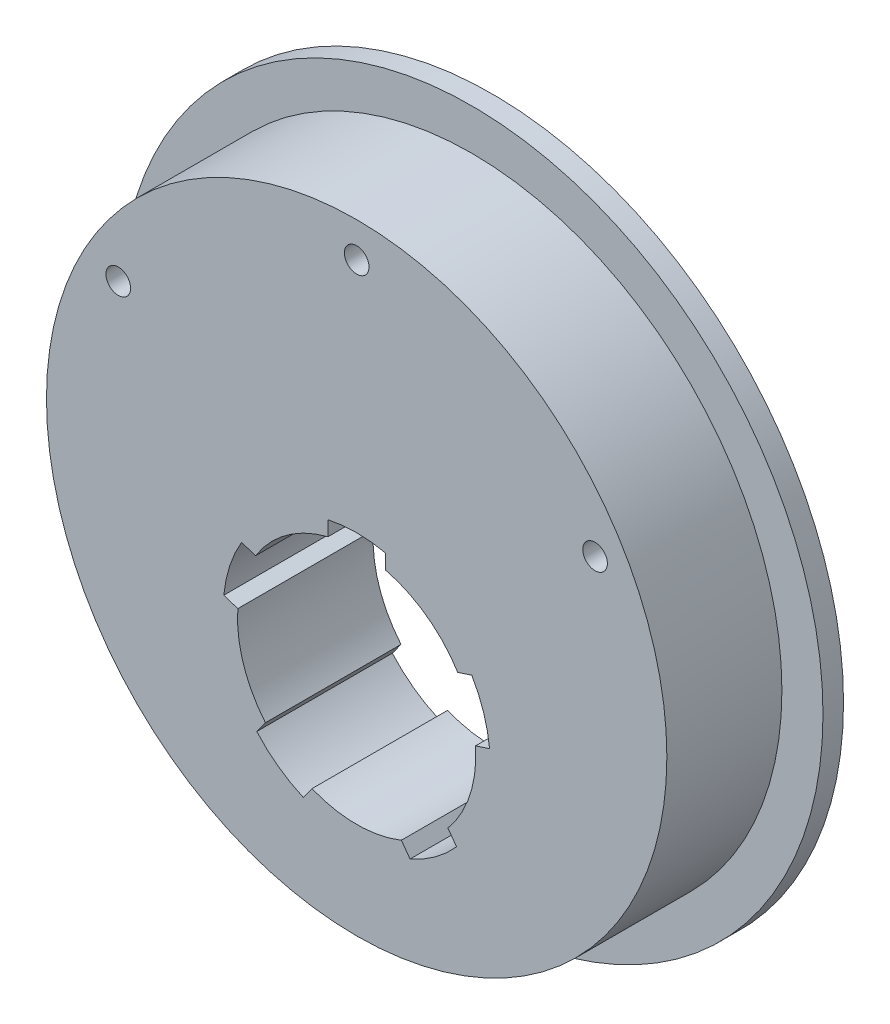
from build123d import *

# Parameters (mm, degrees)
SKETCH2_R                   = 85.5
BOSS_EXTRUDE1_DEPTH         = 5
SKETCH4_R                   = 75.5
BOSS_EXTRUDE2_DEPTH         = 28
SKETCH5_R                   = 29
CUT_EXTRUDE1_DEPTH          = 126.337544256
CUT_EXTRUDE2_DEPTH          = 126.337544256
CIRPATTERN1_COUNT           = 5
SKETCH10_R                  = 3
CUT_EXTRUDE3_DEPTH          = 12
CIRPATTERN2_COUNT           = 2
CIRPATTERN2_ANGLE           = 60
CIRPATTERN3_COPY_1_SKETCH_R = 3
CIRPATTERN3_COPY_1_DEPTH    = 12
CIRPATTERN3_COPY_2_SKETCH_R = 3
CIRPATTERN3_COPY_2_DEPTH    = 12


with BuildPart() as part:
    # Sketch2 → Boss-Extrude1 (new body)
    with BuildSketch(Plane.XY):
        Circle(SKETCH2_R)
    extrude(amount=BOSS_EXTRUDE1_DEPTH)

    # Sketch4 → Boss-Extrude2 (add)
    with BuildSketch(Plane.XY.offset(5)):
        Circle(SKETCH4_R)
    extrude(amount=BOSS_EXTRUDE2_DEPTH)

    # Sketch5 → Cut-Extrude1 (cut, through all)
    with BuildSketch(Plane.XY.offset(33)):
        with Locations((0, -23)):
            Circle(SKETCH5_R)
    extrude(amount=-CUT_EXTRUDE1_DEPTH, mode=Mode.SUBTRACT)

    # Sketch7 → Cut-Extrude2 (cut, symmetric)
    with BuildSketch(Plane.XY.offset(33)):
        with BuildLine():
            Line((-7, 8.737202145), (-7, 5.142494559))
            ThreePointArc((-7, 5.142494559), (0, 6), (7, 5.142494559))
            Line((7, 5.142494559), (7, 8.737202145))
            ThreePointArc((7, 8.737202145), (0, 9.5), (-7, 8.737202145))
        make_face()
    cut_extrude2 = extrude(amount=CUT_EXTRUDE2_DEPTH, both=True, mode=Mode.SUBTRACT)

    # CirPattern1: Cut-Extrude2 ×5 about axis
    cirpattern1_axis = Axis((0, -23, 33), (0, 0, 1))
    for i in range(1, CIRPATTERN1_COUNT):
        add(cut_extrude2.rotate(cirpattern1_axis, i * 360 / CIRPATTERN1_COUNT), mode=Mode.SUBTRACT)

    # Sketch10 → Cut-Extrude3 (cut)
    with BuildSketch(Plane.XY.offset(33)):
        with Locations((0, 67)):
            Circle(SKETCH10_R)
    cut_extrude3 = extrude(amount=-CUT_EXTRUDE3_DEPTH, mode=Mode.SUBTRACT)

    # CirPattern2: Cut-Extrude3 ×2 about axis
    cirpattern2_axis = Axis((0, 0, 5), (0, 0, 1))
    for i in range(1, CIRPATTERN2_COUNT):
        add(cut_extrude3.rotate(cirpattern2_axis, i * CIRPATTERN2_ANGLE / (CIRPATTERN2_COUNT - 1)), mode=Mode.SUBTRACT)

    # CirPattern3 copy 1 sketch → CirPattern3 copy 1 (cut)
    with BuildSketch(Plane.XY.offset(33)):
        with Locations((0, 67)):
            Circle(CIRPATTERN3_COPY_1_SKETCH_R)
    extrude(amount=-CIRPATTERN3_COPY_1_DEPTH, mode=Mode.SUBTRACT)

    # CirPattern3 copy 2 sketch → CirPattern3 copy 2 (cut)
    with BuildSketch(Plane(origin=(0, 0, 33), x_dir=(0.4999999999999978, -0.8660254037844399, 0), z_dir=(0, 0, 1))):
        with Locations((0, 67)):
            Circle(CIRPATTERN3_COPY_2_SKETCH_R)
    extrude(amount=-CIRPATTERN3_COPY_2_DEPTH, mode=Mode.SUBTRACT)


solid = part.part
